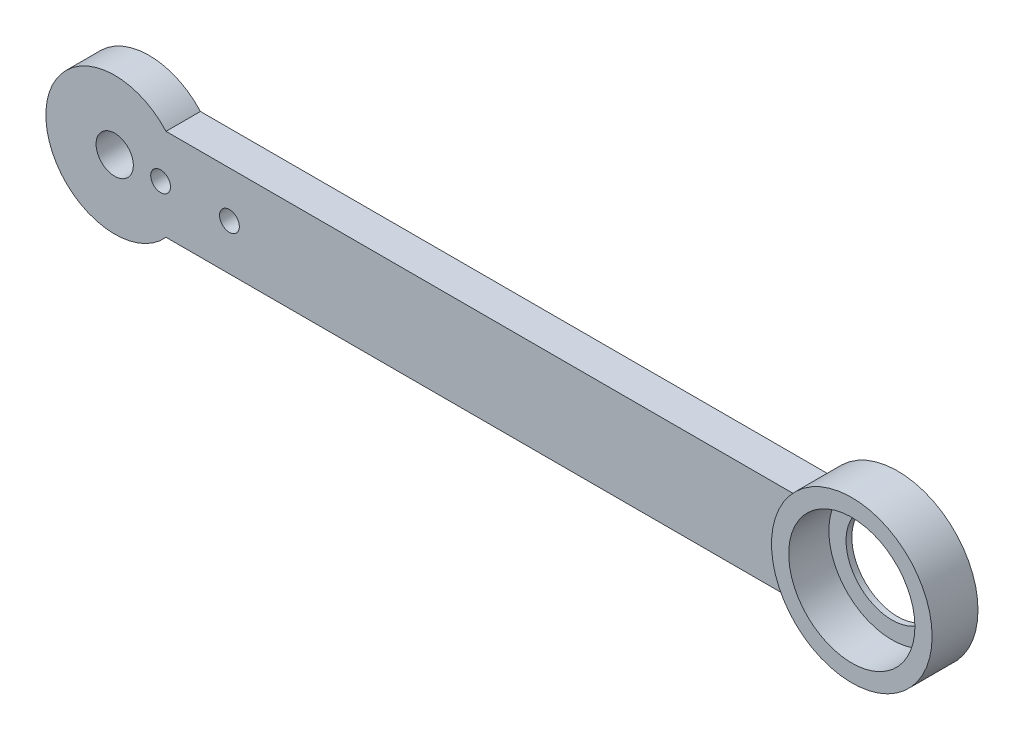
from build123d import *
from build123d.topology import SkipClean

# Parameters (mm, degrees)
BOSS_EXTRUDE1_START     = 3
SKETCH1_W               = 130
SKETCH1_H               = 16
BOSS_EXTRUDE1_DEPTH     = 6
BOSS_EXTRUDE2_START     = 3
SKETCH2_R               = 12
BOSS_EXTRUDE2_DEPTH     = 6
BOSS_EXTRUDE3_START     = 3
SKETCH3_R               = 14
BOSS_EXTRUDE3_DEPTH     = 6
BOSS_EXTRUDE4_START     = 2.5
SKETCH4_R               = 14
BOSS_EXTRUDE4_DEPTH     = 8
CUT_EXTRUDE1_DEPTH      = 146.059470563
CUT_EXTRUDE1_DEPTH_BACK = 146.059470563
SKETCH5_R               = 3.25
CUT_EXTRUDE2_DEPTH      = 146.059470563
CUT_EXTRUDE2_DEPTH_BACK = 146.059470563
SKETCH6_R               = 1.725
CUT_EXTRUDE3_START      = 3
SKETCH7_R               = 2.9
CUT_EXTRUDE3_DEPTH      = 2.2
CUT_EXTRUDE4_START      = 3
SKETCH8_R               = 2.9
CUT_EXTRUDE4_DEPTH      = 2.2
CUT_EXTRUDE5_START      = 3.5
SKETCH9_R               = 11
CUT_EXTRUDE5_DEPTH      = 7
CUT_EXTRUDE6_DEPTH      = 146.059470563
CUT_EXTRUDE6_DEPTH_BACK = 146.059470563
SKETCH10_R              = 8


with BuildPart() as part:
    # Sketch1 → Boss-Extrude1 (new body)
    with BuildSketch(Plane.XY.offset(BOSS_EXTRUDE1_START)):
        with Locations((65, 0)):
            Rectangle(SKETCH1_W, SKETCH1_H)
    extrude(amount=BOSS_EXTRUDE1_DEPTH)

    # Sketch2 → Boss-Extrude2 (add)
    with BuildSketch(Plane.XY.offset(BOSS_EXTRUDE2_START)):
        Circle(SKETCH2_R)
    extrude(amount=BOSS_EXTRUDE2_DEPTH)

    # Sketch3 → Boss-Extrude3 (add)
    with BuildSketch(Plane.XY.offset(BOSS_EXTRUDE3_START)):
        with Locations((130, 0)):
            Circle(SKETCH3_R)
    extrude(amount=BOSS_EXTRUDE3_DEPTH)

    # Sketch4 → Boss-Extrude4 (add)
    with SkipClean():  # the faces are left unmerged after this step: merging them gives an invalid solid
        with BuildSketch(Plane.XY.offset(BOSS_EXTRUDE4_START)):
            with Locations((130, 0)):
                Circle(SKETCH4_R)
        extrude(amount=BOSS_EXTRUDE4_DEPTH)
    add(part.part.scale(1), mode=Mode.REPLACE)  # the faces are merged on a copy

    # Sketch5 → Cut-Extrude1 (cut, two sides: drawn at the far end of the back side and taken through both)
    with BuildSketch(Plane.XY.offset(-CUT_EXTRUDE1_DEPTH_BACK)):
        Circle(SKETCH5_R)
    extrude(amount=CUT_EXTRUDE1_DEPTH + CUT_EXTRUDE1_DEPTH_BACK, mode=Mode.SUBTRACT)

    # Sketch6 → Cut-Extrude2 (cut, two sides: drawn at the far end of the back side and taken through both)
    with BuildSketch(Plane.XY.offset(-CUT_EXTRUDE2_DEPTH_BACK)):
        with Locations((8, 0)):
            Circle(SKETCH6_R)
        with Locations((20, 0)):
            Circle(SKETCH6_R)
    extrude(amount=CUT_EXTRUDE2_DEPTH + CUT_EXTRUDE2_DEPTH_BACK, mode=Mode.SUBTRACT)

    # Sketch7 → Cut-Extrude3 (cut)
    with BuildSketch(Plane.XY.offset(CUT_EXTRUDE3_START)):
        with Locations((8, 0)):
            Circle(SKETCH7_R)
    extrude(amount=CUT_EXTRUDE3_DEPTH, mode=Mode.SUBTRACT)

    # Sketch8 → Cut-Extrude4 (cut)
    with BuildSketch(Plane.XY.offset(CUT_EXTRUDE4_START)):
        with Locations((20, 0)):
            Circle(SKETCH8_R)
    extrude(amount=CUT_EXTRUDE4_DEPTH, mode=Mode.SUBTRACT)

    # Sketch9 → Cut-Extrude5 (cut)
    with BuildSketch(Plane.XY.offset(CUT_EXTRUDE5_START)):
        with Locations((130, 0)):
            Circle(SKETCH9_R)
    extrude(amount=CUT_EXTRUDE5_DEPTH, mode=Mode.SUBTRACT)

    # Sketch10 → Cut-Extrude6 (cut, two sides: drawn at the far end of the back side and taken through both)
    with BuildSketch(Plane.XY.offset(-CUT_EXTRUDE6_DEPTH_BACK)):
        with Locations((130, 0)):
            Circle(SKETCH10_R)
    extrude(amount=CUT_EXTRUDE6_DEPTH + CUT_EXTRUDE6_DEPTH_BACK, mode=Mode.SUBTRACT)


solid = part.part
